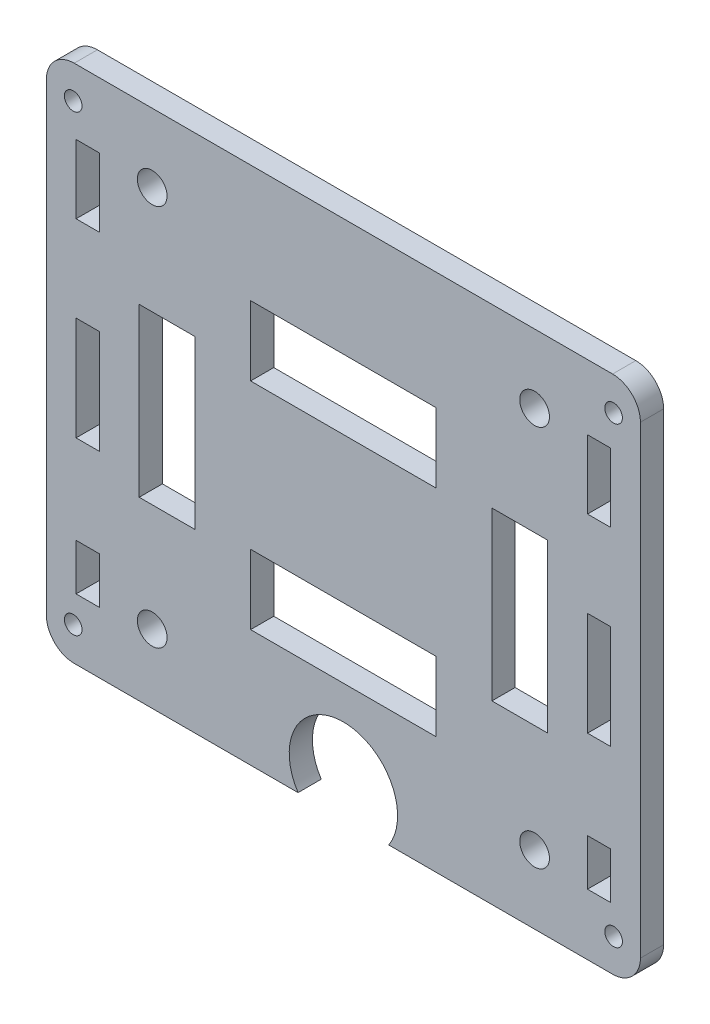
from build123d import *

# Parameters (mm, degrees)
SKETCH1_R           = 0.60325
SKETCH1_R_2         = 1.016
SKETCH1_W           = 1.5875
SKETCH1_H           = 3.175
SKETCH1_W_2         = 12.7
SKETCH1_H_2         = 4.7625
SKETCH1_H_3         = 7.0993
SKETCH1_W_3         = 3.81
SKETCH1_H_4         = 11.43
SKETCH1_H_5         = 4.699
BOSS_EXTRUDE1_DEPTH = 1.5875


with BuildPart() as part:
    # Sketch1 → Boss-Extrude1 (new body)
    with BuildSketch(Plane.XY):
        with BuildLine():
            ThreePointArc((20.32, 15.875), (19.762038418, 17.222038418), (18.415, 17.78))
            Line((18.415, 17.78), (-18.415, 17.78))
            ThreePointArc((-18.415, 17.78), (-19.762038418, 17.222038418), (-20.32, 15.875))
            Line((-20.32, 15.875), (-20.32, -15.875))
            ThreePointArc((-20.32, -15.875), (-19.762038418, -17.222038418), (-18.415, -17.78))
            Line((-18.415, -17.78), (-3.102129359, -17.78))
            ThreePointArc((-3.102129359, -17.78), (-1.060257998, -12.194398512), (3.7084, -15.748))
            ThreePointArc((3.7084, -15.748), (3.553601488, -16.808257998), (3.102129359, -17.78))
            Line((3.102129359, -17.78), (18.415, -17.78))
            ThreePointArc((18.415, -17.78), (19.762038418, -17.222038418), (20.32, -15.875))
            Line((20.32, -15.875), (20.32, 15.875))
        make_face()
        with Locations((-18.484652412, -15.510465022)):
            Circle(SKETCH1_R, mode=Mode.SUBTRACT)
        Polygon((-18.288, -13.599963634), (-18.288, -12.456963634), (-18.288, -10.424963634), (-16.7005, -10.424963634), (-16.7005, -12.456963634), (-16.7005, -13.599963634), align=None, mode=Mode.SUBTRACT)
        with Locations((-13.08, -13.08)):
            Circle(SKETCH1_R_2, mode=Mode.SUBTRACT)
        with Locations((18.484652412, -15.510465022)):
            Circle(SKETCH1_R, mode=Mode.SUBTRACT)
        with Locations((13.08, -13.08)):
            Circle(SKETCH1_R_2, mode=Mode.SUBTRACT)
        with Locations((17.49425, -12.012463634)):
            Rectangle(SKETCH1_W, SKETCH1_H, mode=Mode.SUBTRACT)
        with Locations((0, -7.366)):
            Rectangle(SKETCH1_W_2, SKETCH1_H_2, mode=Mode.SUBTRACT)
        with Locations((-17.49425, -0.80645)):
            Rectangle(SKETCH1_W, SKETCH1_H_3, mode=Mode.SUBTRACT)
        with Locations((-12.065, 0)):
            Rectangle(SKETCH1_W_3, SKETCH1_H_4, mode=Mode.SUBTRACT)
        Polygon((-16.7005, 8.625036366), (-18.288, 8.625036366), (-18.288, 11.165036366), (-18.288, 13.324036366), (-16.7005, 13.324036366), (-16.7005, 11.165036366), align=None, mode=Mode.SUBTRACT)
        with Locations((-13.08, 13.08)):
            Circle(SKETCH1_R_2, mode=Mode.SUBTRACT)
        with Locations((-18.484652412, 15.510465022)):
            Circle(SKETCH1_R, mode=Mode.SUBTRACT)
        with Locations((0, 7.366)):
            Rectangle(SKETCH1_W_2, SKETCH1_H_2, mode=Mode.SUBTRACT)
        with Locations((12.065, 0)):
            Rectangle(SKETCH1_W_3, SKETCH1_H_4, mode=Mode.SUBTRACT)
        with Locations((17.49425, -0.80645)):
            Rectangle(SKETCH1_W, SKETCH1_H_3, mode=Mode.SUBTRACT)
        with Locations((13.08, 13.08)):
            Circle(SKETCH1_R_2, mode=Mode.SUBTRACT)
        with Locations((17.49425, 10.974536366)):
            Rectangle(SKETCH1_W, SKETCH1_H_5, mode=Mode.SUBTRACT)
        with Locations((18.484652412, 15.510465022)):
            Circle(SKETCH1_R, mode=Mode.SUBTRACT)
    extrude(amount=BOSS_EXTRUDE1_DEPTH)


solid = part.part
